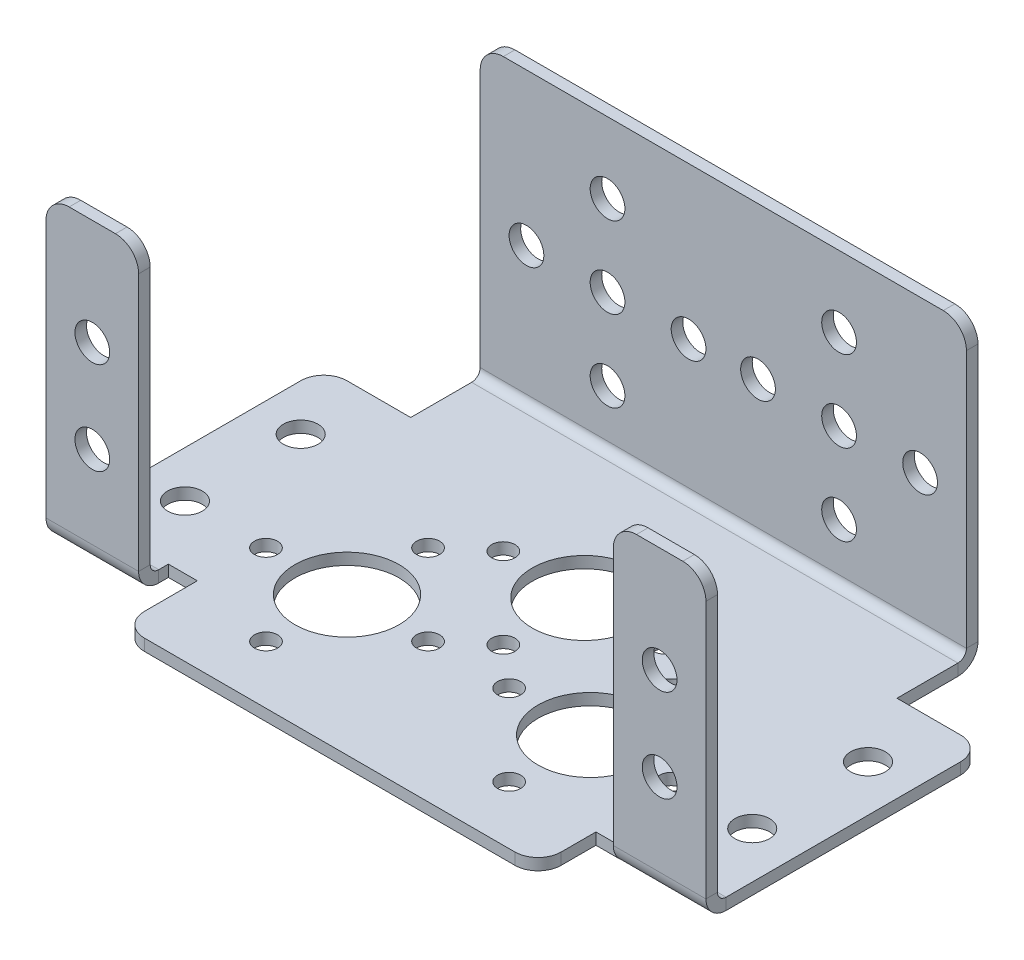
from build123d import *

# Parameters (mm, degrees)
BASE_FLANGE1_DEPTH             = 1
SKETCH15_R                     = 4.5
SKETCH15_R_2                   = 1
SKETCH15_R_3                   = 1.5
CUT_EXTRUDE1_DEPTH             = 10
EDGE_FLANGE2_STRIP_W           = 5.4732
EDGE_FLANGE2_STRIP_H           = 1
EDGE_FLANGE2_STRIP_CUT_DEPTH   = 42
EDGE_FLANGE2_DEPTH             = 42
EDGE_FLANGE3_STRIP_W           = 9.4732
EDGE_FLANGE3_STRIP_H           = 1
EDGE_FLANGE3_STRIP_CUT_DEPTH   = 8
EDGE_FLANGE3_STRIP_2_W         = 9.4732
EDGE_FLANGE3_STRIP_2_H         = 1
EDGE_FLANGE3_STRIP_CUT_2_DEPTH = 8
EDGE_FLANGE3_RELIEF_W          = 9.9732
EDGE_FLANGE3_RELIEF_H          = 0.5
EDGE_FLANGE3_RELIEF_CUT_DEPTH  = 1
EDGE_FLANGE3_DEPTH             = 8
EDGE_FLANGE3_BEND_DEPTH        = 8
FILLET2_R                      = 2
CUT_EXTRUDE2_REACH             = 53.422
SKETCH51_R                     = 1.5
CUT_EXTRUDE3_REACH             = 51.49
SKETCH52_R                     = 1.5


# Sheet-metal steps are written as plain solids
with BuildPart() as part:
    # Sketch1 → Base-Flange1 (new body)
    with BuildSketch(Plane(origin=(0, 0, 0), x_dir=(1, 0, 0), z_dir=(0, 1, 0))):
        with BuildLine():
            Line((28.5, -12.861747752), (20.5, -12.861747752))
            Line((20.5, -12.861747752), (20.5, -7.861747752))
            Line((20.5, -7.861747752), (18, -7.861747752))
            Line((18, -7.861747752), (18, -12.861747752))
            Line((18, -12.861747752), (-18, -12.861747752))
            Line((-18, -12.861747752), (-18, -6.292454879))
            Line((-18, -6.292454879), (-20.5, -6.292454879))
            Line((-20.5, -6.292454879), (-20.5, -12.861747752))
            Line((-20.5, -12.861747752), (-28.5, -12.861747752))
            Line((-28.5, -12.861747752), (-28.5, 13.138252248))
            ThreePointArc((-28.5, 13.138252248), (-27.914213562, 14.552465811), (-26.5, 15.138252248))
            Line((-26.5, 15.138252248), (-21, 15.138252248))
            Line((-21, 15.138252248), (-21, 22.138252248))
            Line((-21, 22.138252248), (21, 22.138252248))
            Line((21, 22.138252248), (21, 15.138252248))
            Line((21, 15.138252248), (26.5, 15.138252248))
            ThreePointArc((26.5, 15.138252248), (27.914213562, 14.552465811), (28.5, 13.138252248))
            Line((28.5, 13.138252248), (28.5, -12.861747752))
        make_face()
    extrude(amount=BASE_FLANGE1_DEPTH)

    # Sketch15 → Cut-Extrude1 (cut)
    with BuildSketch(Plane(origin=(0, 1, 0), x_dir=(1, 0, 0), z_dir=(0, 1, 0))):
        with Locations(Location((-10.5, -0.861747752, 0), (0, 0, 270))):
            Circle(SKETCH15_R)
        with Locations(Location((10.5, -0.861747752, 0), (0, 0, 270))):
            Circle(SKETCH15_R)
        with Locations(Location((-10.5, 6.138252248, 0), (0, 0, 270))):
            Circle(SKETCH15_R_2)
        with Locations(Location((-10.5, -7.861747752, 0), (0, 0, 270))):
            Circle(SKETCH15_R_2)
        with Locations(Location((-17.5, -0.861747752, 0), (0, 0, 270))):
            Circle(SKETCH15_R_2)
        with Locations(Location((-3.5, -0.861747752, 0), (0, 0, 270))):
            Circle(SKETCH15_R_2)
        with Locations(Location((3.5, -0.861747752, 0), (0, 0, 270))):
            Circle(SKETCH15_R_2)
        with Locations(Location((17.5, -0.861747752, 0), (0, 0, 270))):
            Circle(SKETCH15_R_2)
        with Locations(Location((10.5, -7.861747752, 0), (0, 0, 270))):
            Circle(SKETCH15_R_2)
        with Locations(Location((10.5, 6.138252248, 0), (0, 0, 270))):
            Circle(SKETCH15_R_2)
        with Locations(Location((0, 9.138252248, 0), (0, 0, 270))):
            Circle(SKETCH15_R)
        with Locations(Location((0, 2.138252248, 0), (0, 0, 270))):
            Circle(SKETCH15_R_2)
        with Locations(Location((-7, 9.138252248, 0), (0, 0, 270))):
            Circle(SKETCH15_R_2)
        with Locations(Location((7, 9.138252248, 0), (0, 0, 270))):
            Circle(SKETCH15_R_2)
        with Locations(Location((0, 16.138252248, 0), (0, 0, 270))):
            Circle(SKETCH15_R_2)
        with Locations(Location((-24.5, 9.138252248, 0), (0, 0, 270))):
            Circle(SKETCH15_R_3)
        with Locations(Location((-24.5, -0.861747752, 0), (0, 0, 270))):
            Circle(SKETCH15_R_3)
        with Locations(Location((24.5, -0.861747752, 0), (0, 0, 90))):
            Circle(SKETCH15_R_3)
        with Locations(Location((24.5, 9.138252248, 0), (0, 0, 90))):
            Circle(SKETCH15_R_3)
    extrude(amount=-CUT_EXTRUDE1_DEPTH, mode=Mode.SUBTRACT)

    # Edge-Flange2 strip (across the edge) → Edge-Flange2 strip cut (cut)
    with BuildSketch(Plane(origin=(21, 1, -22.138252248), x_dir=(0, 0, 1), z_dir=(-1, 0, 0))):
        with Locations((-1, -0.5)):
            Rectangle(EDGE_FLANGE2_STRIP_W, EDGE_FLANGE2_STRIP_H)
    extrude(amount=EDGE_FLANGE2_STRIP_CUT_DEPTH, mode=Mode.SUBTRACT)

    # Edge-Flange2 section (across the edge) → Edge-Flange2 (add)
    with BuildSketch(Plane(origin=(21, 1, -22.138252248), x_dir=(0, 0, 1), z_dir=(-1, 0, 0))):
        with BuildLine():
            Line((0, 0.7366), (0, 25))
            Line((0, 25), (1, 25))
            Line((1, 25), (1, 0.7366))
            ThreePointArc((1, 0.7366), (1.215745145, 0.215745145), (1.7366, 0))
            Line((1.7366, 0), (1.7366, -1))
            ThreePointArc((1.7366, -1), (0.508638364, -0.491361636), (0, 0.7366))
        make_face()
    extrude(amount=EDGE_FLANGE2_DEPTH)

    # Edge-Flange3 strip (across the edge) → Edge-Flange3 strip cut (cut)
    with BuildSketch(Plane(origin=(-28.5, 1, 8.861747752), x_dir=(0, 0, -1), z_dir=(1, 0, 0))):
        with Locations((-3, -0.5)):
            Rectangle(EDGE_FLANGE3_STRIP_W, EDGE_FLANGE3_STRIP_H)
    extrude(amount=EDGE_FLANGE3_STRIP_CUT_DEPTH, mode=Mode.SUBTRACT)

    # Edge-Flange3 strip 2 (across the edge) → Edge-Flange3 strip cut 2 (cut)
    with BuildSketch(Plane(origin=(20.5, 1, 8.861747752), x_dir=(0, 0, -1), z_dir=(1, 0, 0))):
        with Locations((-3, -0.5)):
            Rectangle(EDGE_FLANGE3_STRIP_2_W, EDGE_FLANGE3_STRIP_2_H)
    extrude(amount=EDGE_FLANGE3_STRIP_CUT_2_DEPTH, mode=Mode.SUBTRACT)

    # Edge-Flange3 relief (on the sheet) → Edge-Flange3 relief cut (cut)
    with BuildSketch(Plane(origin=(20.5, 1, 7.125147752), x_dir=(0, 0, -1), z_dir=(0, 1, 0))):
        with Locations((-4.4866, 0.25)):
            Rectangle(EDGE_FLANGE3_RELIEF_W, EDGE_FLANGE3_RELIEF_H)
    extrude(amount=-EDGE_FLANGE3_RELIEF_CUT_DEPTH, mode=Mode.SUBTRACT)

    # Edge-Flange3 section (across the edge) → Edge-Flange3 (add)
    with BuildSketch(Plane(origin=(-28.5, 1, 8.861747752), x_dir=(0, 0, -1), z_dir=(1, 0, 0))):
        with BuildLine():
            Line((0, 0.7366), (0, 25))
            Line((0, 25), (1, 25))
            Line((1, 25), (1, 0.7366))
            ThreePointArc((1, 0.7366), (1.215745145, 0.215745145), (1.7366, 0))
            Line((1.7366, 0), (1.7366, -1))
            ThreePointArc((1.7366, -1), (0.508638364, -0.491361636), (0, 0.7366))
        make_face()
    extrude(amount=EDGE_FLANGE3_DEPTH)

    # Edge-Flange3 section 2 (across the edge) → Edge-Flange3 bend (add)
    with BuildSketch(Plane(origin=(20.5, 1, 8.861747752), x_dir=(0, 0, -1), z_dir=(1, 0, 0))):
        with BuildLine():
            Line((0, 0.7366), (0, 25))
            Line((0, 25), (1, 25))
            Line((1, 25), (1, 0.7366))
            ThreePointArc((1, 0.7366), (1.215745145, 0.215745145), (1.7366, 0))
            Line((1.7366, 0), (1.7366, -1))
            ThreePointArc((1.7366, -1), (0.508638364, -0.491361636), (0, 0.7366))
        make_face()
    extrude(amount=EDGE_FLANGE3_BEND_DEPTH)

    # Fillet2
    fillet2_edges = [part.edges().sort_by_distance(p)[0] for p in [
        (21, 26, -21.638252248),
        (-21, 26, -21.638252248),
        (-28.5, 26, 8.361747752),
        (-20.5, 26, 8.361747752),
        (20.5, 26, 8.361747752),
        (28.5, 26, 8.361747752),
        (18, 0.5, 12.861747752),
        (-18, 0.5, 12.861747752),
    ]]
    fillet(fillet2_edges, radius=FILLET2_R)

    # Sketch51 → Cut-Extrude2 (cut, up to next)
    with BuildSketch(Plane.XY.offset(-21.138252248), mode=Mode.PRIVATE) as cut_extrude2_sk1:
        with Locations((-10, 12.87)):
            Circle(SKETCH51_R)
    cut_extrude2_tool1 = extrude(cut_extrude2_sk1.sketch, amount=-CUT_EXTRUDE2_REACH, mode=Mode.PRIVATE) & part.part
    # Sketch51 → Cut-Extrude2 (cut, up to next)
    with BuildSketch(Plane.XY.offset(-21.138252248), mode=Mode.PRIVATE) as cut_extrude2_sk2:
        with Locations((-10, 19.87)):
            Circle(SKETCH51_R)
    cut_extrude2_tool2 = extrude(cut_extrude2_sk2.sketch, amount=-CUT_EXTRUDE2_REACH, mode=Mode.PRIVATE) & part.part
    # Sketch51 → Cut-Extrude2 (cut, up to next)
    with BuildSketch(Plane.XY.offset(-21.138252248), mode=Mode.PRIVATE) as cut_extrude2_sk3:
        with Locations((-17, 12.87)):
            Circle(SKETCH51_R)
    cut_extrude2_tool3 = extrude(cut_extrude2_sk3.sketch, amount=-CUT_EXTRUDE2_REACH, mode=Mode.PRIVATE) & part.part
    # Sketch51 → Cut-Extrude2 (cut, up to next)
    with BuildSketch(Plane.XY.offset(-21.138252248), mode=Mode.PRIVATE) as cut_extrude2_sk4:
        with Locations((-3, 12.87)):
            Circle(SKETCH51_R)
    cut_extrude2_tool4 = extrude(cut_extrude2_sk4.sketch, amount=-CUT_EXTRUDE2_REACH, mode=Mode.PRIVATE) & part.part
    # Sketch51 → Cut-Extrude2 (cut, up to next)
    with BuildSketch(Plane.XY.offset(-21.138252248), mode=Mode.PRIVATE) as cut_extrude2_sk5:
        with Locations((-10, 5.87)):
            Circle(SKETCH51_R)
    cut_extrude2_tool5 = extrude(cut_extrude2_sk5.sketch, amount=-CUT_EXTRUDE2_REACH, mode=Mode.PRIVATE) & part.part
    # Sketch51 → Cut-Extrude2 (cut, up to next)
    with BuildSketch(Plane.XY.offset(-21.138252248), mode=Mode.PRIVATE) as cut_extrude2_sk6:
        with Locations(Location((10, 5.87, 0), (0, 0, 270))):
            Circle(SKETCH51_R)
    cut_extrude2_tool6 = extrude(cut_extrude2_sk6.sketch, amount=-CUT_EXTRUDE2_REACH, mode=Mode.PRIVATE) & part.part
    # Sketch51 → Cut-Extrude2 (cut, up to next)
    with BuildSketch(Plane.XY.offset(-21.138252248), mode=Mode.PRIVATE) as cut_extrude2_sk7:
        with Locations(Location((3, 12.87, 0), (0, 0, 270))):
            Circle(SKETCH51_R)
    cut_extrude2_tool7 = extrude(cut_extrude2_sk7.sketch, amount=-CUT_EXTRUDE2_REACH, mode=Mode.PRIVATE) & part.part
    # Sketch51 → Cut-Extrude2 (cut, up to next)
    with BuildSketch(Plane.XY.offset(-21.138252248), mode=Mode.PRIVATE) as cut_extrude2_sk8:
        with Locations(Location((17, 12.87, 0), (0, 0, 270))):
            Circle(SKETCH51_R)
    cut_extrude2_tool8 = extrude(cut_extrude2_sk8.sketch, amount=-CUT_EXTRUDE2_REACH, mode=Mode.PRIVATE) & part.part
    # Sketch51 → Cut-Extrude2 (cut, up to next)
    with BuildSketch(Plane.XY.offset(-21.138252248), mode=Mode.PRIVATE) as cut_extrude2_sk9:
        with Locations(Location((10, 19.87, 0), (0, 0, 270))):
            Circle(SKETCH51_R)
    cut_extrude2_tool9 = extrude(cut_extrude2_sk9.sketch, amount=-CUT_EXTRUDE2_REACH, mode=Mode.PRIVATE) & part.part
    # Sketch51 → Cut-Extrude2 (cut, up to next)
    with BuildSketch(Plane.XY.offset(-21.138252248), mode=Mode.PRIVATE) as cut_extrude2_sk10:
        with Locations(Location((10, 12.87, 0), (0, 0, 270))):
            Circle(SKETCH51_R)
    cut_extrude2_tool10 = extrude(cut_extrude2_sk10.sketch, amount=-CUT_EXTRUDE2_REACH, mode=Mode.PRIVATE) & part.part
    add(cut_extrude2_tool1.solids().sort_by_distance((-10, 12.87, -21.138252))[0], mode=Mode.SUBTRACT)
    add(cut_extrude2_tool2.solids().sort_by_distance((-10, 19.87, -21.138252))[0], mode=Mode.SUBTRACT)
    add(cut_extrude2_tool3.solids().sort_by_distance((-17, 12.87, -21.138252))[0], mode=Mode.SUBTRACT)
    add(cut_extrude2_tool4.solids().sort_by_distance((-3, 12.87, -21.138252))[0], mode=Mode.SUBTRACT)
    add(cut_extrude2_tool5.solids().sort_by_distance((-10, 5.87, -21.138252))[0], mode=Mode.SUBTRACT)
    add(cut_extrude2_tool6.solids().sort_by_distance((10, 5.87, -21.138252))[0], mode=Mode.SUBTRACT)
    add(cut_extrude2_tool7.solids().sort_by_distance((3, 12.87, -21.138252))[0], mode=Mode.SUBTRACT)
    add(cut_extrude2_tool8.solids().sort_by_distance((17, 12.87, -21.138252))[0], mode=Mode.SUBTRACT)
    add(cut_extrude2_tool9.solids().sort_by_distance((10, 19.87, -21.138252))[0], mode=Mode.SUBTRACT)
    add(cut_extrude2_tool10.solids().sort_by_distance((10, 12.87, -21.138252))[0], mode=Mode.SUBTRACT)

    # Sketch52 → Cut-Extrude3 (cut, up to next)
    with BuildSketch(Plane.XY.offset(8.861747752), mode=Mode.PRIVATE) as cut_extrude3_sk1:
        with Locations((-24.5, 16.8683)):
            Circle(SKETCH52_R)
    cut_extrude3_tool1 = extrude(cut_extrude3_sk1.sketch, amount=-CUT_EXTRUDE3_REACH, mode=Mode.PRIVATE) & part.part
    # Sketch52 → Cut-Extrude3 (cut, up to next)
    with BuildSketch(Plane.XY.offset(8.861747752), mode=Mode.PRIVATE) as cut_extrude3_sk2:
        with Locations((-24.5, 8.8683)):
            Circle(SKETCH52_R)
    cut_extrude3_tool2 = extrude(cut_extrude3_sk2.sketch, amount=-CUT_EXTRUDE3_REACH, mode=Mode.PRIVATE) & part.part
    # Sketch52 → Cut-Extrude3 (cut, up to next)
    with BuildSketch(Plane.XY.offset(8.861747752), mode=Mode.PRIVATE) as cut_extrude3_sk3:
        with Locations(Location((24.5, 8.8683, 0), (0, 0, 180))):
            Circle(SKETCH52_R)
    cut_extrude3_tool3 = extrude(cut_extrude3_sk3.sketch, amount=-CUT_EXTRUDE3_REACH, mode=Mode.PRIVATE) & part.part
    # Sketch52 → Cut-Extrude3 (cut, up to next)
    with BuildSketch(Plane.XY.offset(8.861747752), mode=Mode.PRIVATE) as cut_extrude3_sk4:
        with Locations(Location((24.5, 16.8683, 0), (0, 0, 180))):
            Circle(SKETCH52_R)
    cut_extrude3_tool4 = extrude(cut_extrude3_sk4.sketch, amount=-CUT_EXTRUDE3_REACH, mode=Mode.PRIVATE) & part.part
    add(cut_extrude3_tool1.solids().sort_by_distance((-24.5, 16.8683, 8.861748))[0], mode=Mode.SUBTRACT)
    add(cut_extrude3_tool2.solids().sort_by_distance((-24.5, 8.8683, 8.861748))[0], mode=Mode.SUBTRACT)
    add(cut_extrude3_tool3.solids().sort_by_distance((24.5, 8.8683, 8.861748))[0], mode=Mode.SUBTRACT)
    add(cut_extrude3_tool4.solids().sort_by_distance((24.5, 16.8683, 8.861748))[0], mode=Mode.SUBTRACT)


solid = part.part
